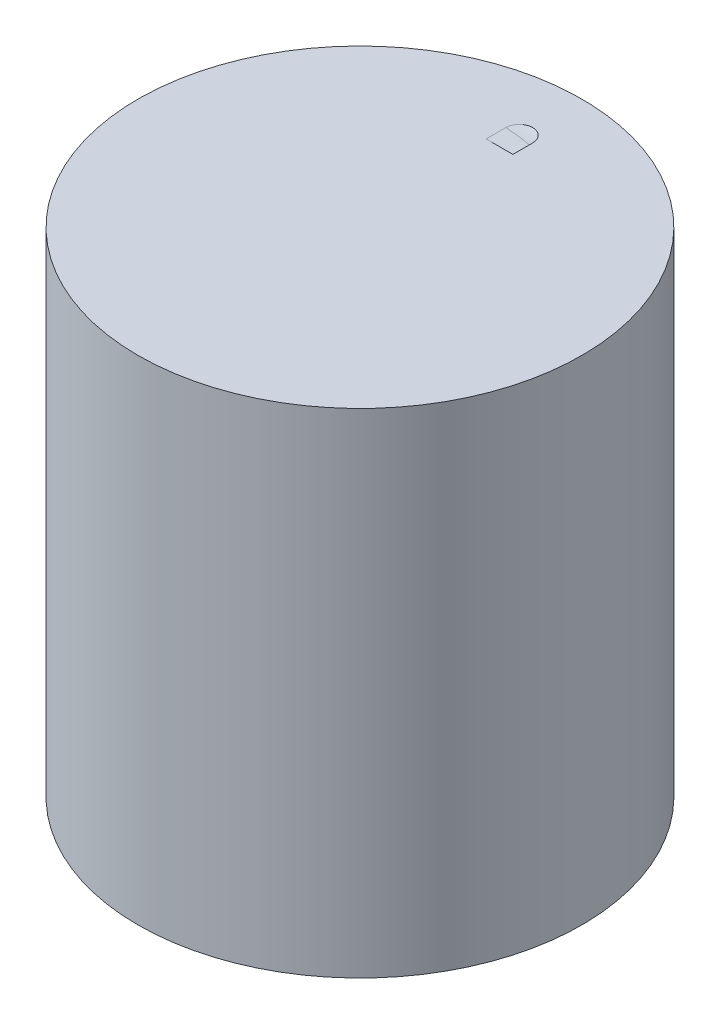
from build123d import *

# Parameters (mm, degrees)
SKETCH1_R           = 45
BOSS_EXTRUDE1_DEPTH = 100
CUT_SWEEP3_PITCH    = 30


with BuildPart() as part:
    # Sketch1 → Boss-Extrude1 (new body)
    with BuildSketch(Plane(origin=(0, 0, 0), x_dir=(1, 0, 0), z_dir=(0, 1, 0))):
        with Locations(Location((0, 0, 0), (0, 0, 270))):
            Circle(SKETCH1_R)
    extrude(amount=BOSS_EXTRUDE1_DEPTH)

    # Cut-Sweep3: the profile of Sketch12 screwed along a right-hand helix of 4 turns, 22 arcs to a turn; built about Z, then put on its axis
    cut_sweep3_z = Axis((0, 0, 0), (0, 0, 1))
    cut_sweep3_corners = [(24.748737342, 20.91569388, 0), (21.920310217, 18.087266755, 0), (18.087266755, 21.920310217, 0), (20.91569388, 24.748737342, 0), (24.748737342, 24.748737342, 0)]
    with BuildLine(mode=Mode.PRIVATE) as cut_sweep3_profile:
        Line(cut_sweep3_corners[0], cut_sweep3_corners[1])
        Line(cut_sweep3_corners[1], cut_sweep3_corners[2])
        Line(cut_sweep3_corners[2], cut_sweep3_corners[3])
        ThreePointArc((20.91569388, 24.748737342, 0), (22.832215611, 25.542586635, 0), (24.748737342, 24.748737342, 0))
        ThreePointArc((24.748737342, 24.748737342, 0), (25.542586635, 22.832215611, 0), (24.748737342, 20.91569388, 0))
    cut_sweep3_cap = Face(cut_sweep3_profile.wire())
    cut_sweep3_arcs = [((20.91569388, 24.748737342, 0), (22.832215611, 26.665259072, 0), (24.748737342, 24.748737342, 0), (1, 0.7071067811865476, 1)), ((24.748737342, 24.748737342, 0), (26.665259072, 22.832215611, 0), (24.748737342, 20.91569388, 0), (1, 0.7071067811865476, 1))]  # start, shoulder, end, weights
    cut_sweep3_turn_angles = [0, 8.181818182, 16.363636364, 24.545454545, 32.727272727, 40.909090909, 49.090909091, 57.272727273, 65.454545455, 73.636363636, 81.818181818, 90, 98.181818182, 106.363636364, 114.545454545, 122.727272727, 130.909090909, 139.090909091, 147.272727273, 155.454545455, 163.636363636, 171.818181818, 180, 188.181818182, 196.363636364, 204.545454545, 212.727272727, 220.909090909, 229.090909091, 237.272727273, 245.454545455, 253.636363636, 261.818181818, 270, 278.181818182, 286.363636364, 294.545454545, 302.727272727, 310.909090909, 319.090909091, 327.272727273, 335.454545455, 343.636363636, 351.818181818, 360]
    cut_sweep3_turn_weights = [1, 0.9898214418809327, 1, 0.9898214418809327, 1, 0.9898214418809327, 1, 0.9898214418809327, 1, 0.9898214418809327, 1, 0.9898214418809327, 1, 0.9898214418809327, 1, 0.9898214418809327, 1, 0.9898214418809327, 1, 0.9898214418809328, 1, 0.9898214418809327, 1, 0.9898214418809327, 1, 0.9898214418809328, 1, 0.9898214418809327, 1, 0.9898214418809328, 1, 0.9898214418809327, 1, 0.9898214418809327, 1, 0.9898214418809327, 1, 0.9898214418809328, 1, 0.9898214418809327, 1, 0.9898214418809327, 1, 0.9898214418809327, 1]
    cut_sweep3_turn_rails = [Edge.make_bspline([Vector(p[0], p[1], 0).rotate(cut_sweep3_z, cut_sweep3_turn_angles[k]) / cut_sweep3_turn_weights[k] + Vector(0, 0, p[2] + CUT_SWEEP3_PITCH * cut_sweep3_turn_angles[k] / 360) for k in range(45)], [0, 0, 0, 1, 1, 2, 2, 3, 3, 4, 4, 5, 5, 6, 6, 7, 7, 8, 8, 9, 9, 10, 10, 11, 11, 12, 12, 13, 13, 14, 14, 15, 15, 16, 16, 17, 17, 18, 18, 19, 19, 20, 20, 21, 21, 22, 22, 22], 2, cut_sweep3_turn_weights) for p in cut_sweep3_corners]
    cut_sweep3_turn_sides = [*[Face.make_surface_from_curves(cut_sweep3_turn_rails[p[0]], cut_sweep3_turn_rails[p[1]]) for p in [(0, 1), (1, 2), (2, 3)]], *[Face.make_bezier_surface([[Vector(p[j][0], p[j][1], 0).rotate(cut_sweep3_z, cut_sweep3_turn_angles[2 * i + k]) / cut_sweep3_turn_weights[2 * i + k] + Vector(0, 0, p[j][2] + CUT_SWEEP3_PITCH * cut_sweep3_turn_angles[2 * i + k] / 360) for k in range(3)] for j in range(3)], [[p[3][j] * cut_sweep3_turn_weights[2 * i + k] for k in range(3)] for j in range(3)]) for p in cut_sweep3_arcs for i in range(22)]]
    cut_sweep3 = Plane(origin=(0, 100, 0), x_dir=(-0.7071067811865537, 0, -0.7071067811865414), z_dir=(0, -1, 0)) * Solid(Shell([*[p.moved(Location((0, 0, CUT_SWEEP3_PITCH * i))) for i in range(4) for p in cut_sweep3_turn_sides], cut_sweep3_cap, cut_sweep3_cap.rotate(cut_sweep3_z, 1440).moved(Location((0, 0, CUT_SWEEP3_PITCH * 1440 / 360)))]))
    add(cut_sweep3, mode=Mode.SUBTRACT)


solid = part.part
